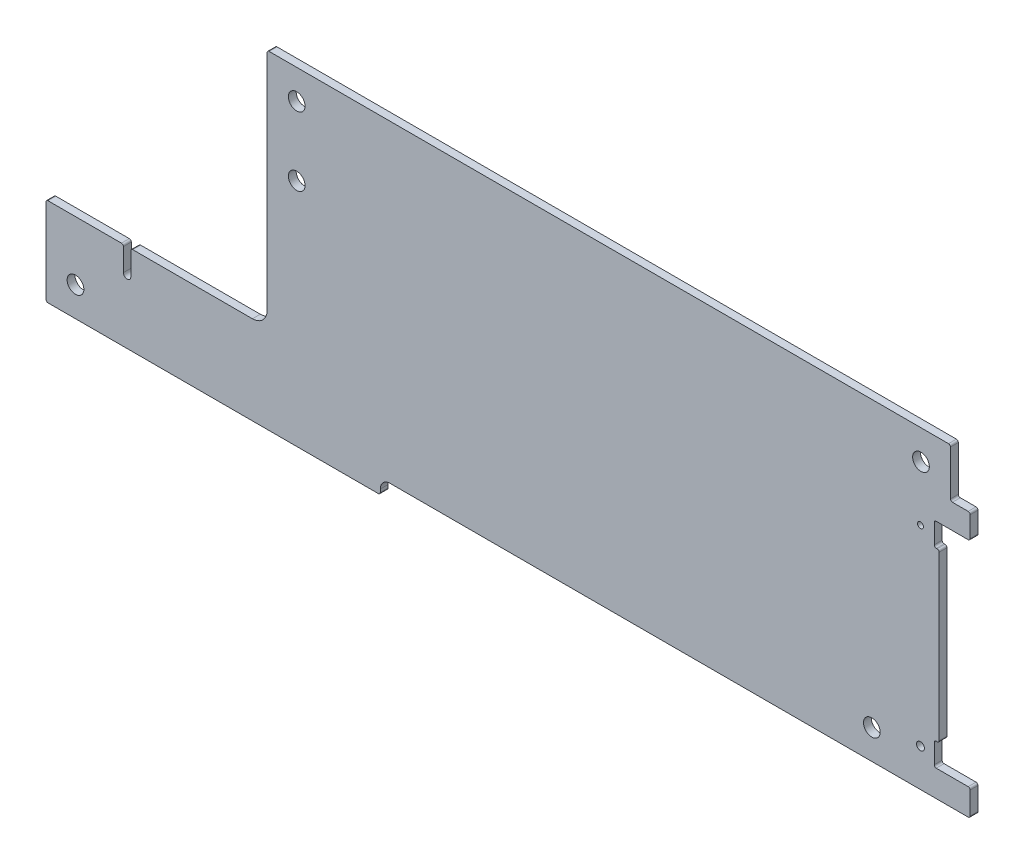
from build123d import *

# Parameters (mm, degrees)
BOSS_EXTRUDE1_DEPTH  = 1.6
SKETCH4_R            = 0.6
SKETCH4_R_2          = 0.8
CUT_EXTRUDE1_DEPTH   = 199.537150176
CUT_EXTRUDE2_DEPTH   = 199.537150176
CUT_EXTRUDE3_DEPTH   = 199.537150176
FILLET1_R            = 0.4
M3_CLEARANCE_HOLE1_D = 3.4


with BuildPart() as part:
    # Sketch2 → Boss-Extrude1 (new body)
    with BuildSketch(Plane.XY):
        with BuildLine():
            Line((68, -2), (68, -3))
            Line((68, -3), (0, -3))
            Line((0, -3), (0, 0))
            Line((0, 0), (0, 15))
            Line((0, 15), (42, 15))
            ThreePointArc((42, 15), (44.121320344, 15.878679656), (45, 18))
            Line((45, 18), (45, 63.8))
            Line((45, 63.8), (188, 63.8))
            Line((188, 63.8), (188, 0))
            Line((188, 0), (70, 0))
            ThreePointArc((70, 0), (68.585786438, -0.585786438), (68, -2))
        make_face()
    extrude(amount=BOSS_EXTRUDE1_DEPTH)

    # Sketch4 → Cut-Extrude1 (cut, through all)
    with BuildSketch(Plane(origin=(0, 0, 0), x_dir=(-1, 0, 0), z_dir=(0, 0, -1))):
        with Locations((-177.9, 46.591)):
            Circle(SKETCH4_R)
        with Locations((-177.9, 7.651)):
            Circle(SKETCH4_R_2)
        with BuildLine():
            Line((-188, 49.271), (-188, 48.871))
            Line((-188, 48.871), (-188, 5.371))
            Line((-188, 5.371), (-188, 4.971))
            ThreePointArc((-188, 4.971), (-187.882842712, 5.253842712), (-187.6, 5.371))
            Line((-187.6, 5.371), (-181.1, 5.371))
            ThreePointArc((-181.1, 5.371), (-180.817157288, 5.488157288), (-180.7, 5.771))
            Line((-180.7, 5.771), (-180.7, 9.721))
            ThreePointArc((-180.7, 9.721), (-180.817157288, 10.003842712), (-181.1, 10.121))
            Line((-181.1, 10.121), (-181.3, 10.121))
            ThreePointArc((-181.3, 10.121), (-181.582842712, 10.238157288), (-181.7, 10.521))
            Line((-181.7, 10.521), (-181.7, 43.721))
            ThreePointArc((-181.7, 43.721), (-181.582842712, 44.003842712), (-181.3, 44.121))
            Line((-181.3, 44.121), (-181.1, 44.121))
            ThreePointArc((-181.1, 44.121), (-180.817157288, 44.238157288), (-180.7, 44.521))
            Line((-180.7, 44.521), (-180.7, 48.471))
            ThreePointArc((-180.7, 48.471), (-180.817157288, 48.753842712), (-181.1, 48.871))
            Line((-181.1, 48.871), (-187.6, 48.871))
            ThreePointArc((-187.6, 48.871), (-187.882842712, 48.988157288), (-188, 49.271))
        make_face()
    extrude(amount=-CUT_EXTRUDE1_DEPTH, mode=Mode.SUBTRACT)

    # Sketch5 → Cut-Extrude2 (cut, through all)
    with BuildSketch(Plane.XY.offset(1.6)):
        with BuildLine():
            Line((15.75, 15), (17.25, 15))
            Line((17.25, 15), (17.25, 10))
            ThreePointArc((17.25, 10), (16.5, 9.25), (15.75, 10))
            Line((15.75, 10), (15.75, 15))
        make_face()
    extrude(amount=-CUT_EXTRUDE2_DEPTH, mode=Mode.SUBTRACT)

    # Sketch6 → Cut-Extrude3 (cut, through all)
    with BuildSketch(Plane.XY.offset(1.6)):
        with BuildLine():
            Line((188, 63.8), (184, 63.8))
            Line((184, 63.8), (184, 54.271))
            ThreePointArc((184, 54.271), (184.117157288, 53.988157288), (184.4, 53.871))
            Line((184.4, 53.871), (187.6, 53.871))
            ThreePointArc((187.6, 53.871), (187.882842712, 53.753842712), (188, 53.471))
            Line((188, 53.471), (188, 53.871))
            Line((188, 53.871), (188, 63.8))
        make_face()
    extrude(amount=-CUT_EXTRUDE3_DEPTH, mode=Mode.SUBTRACT)

    # Fillet1
    fillet1_edges = [part.edges().sort_by_distance(p)[0] for p in [
        (15.75, 15, 0.8),
        (17.25, 15, 0.8),
        (0, -3, 0.8),
        (68, -3, 0.8),
        (0, 15, 0.8),
        (45, 63.8, 0.8),
        (188, 0, 0.8),
        (184, 63.8, 0.8),
    ]]
    fillet(fillet1_edges, radius=FILLET1_R)

    # M3 Clearance Hole1 (through all)
    with Locations(Plane(origin=(0, 0, 0), x_dir=(-1, 0, 0), z_dir=(0, 0, -1))):
        with Locations((-178, 57.8), (-51, 57.8), (-6, 3), (-168, 6), (-51, 43.8)):
            Hole(M3_CLEARANCE_HOLE1_D / 2)


solid = part.part
